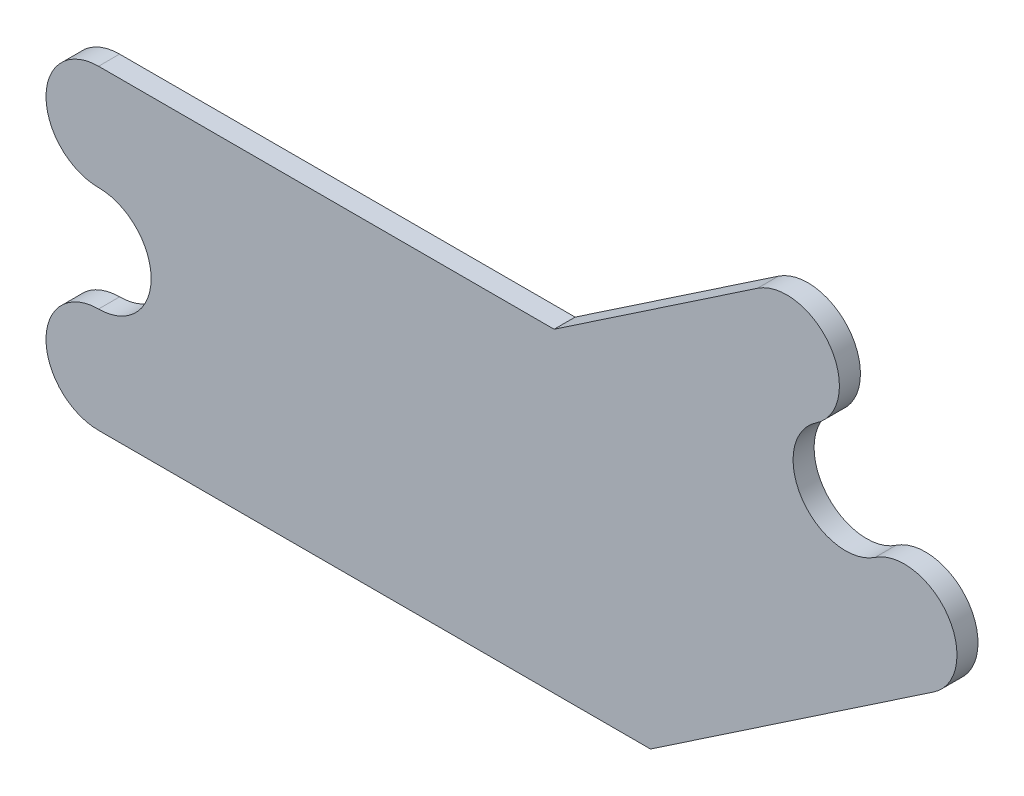
from build123d import *

# Parameters (mm, degrees)
SM_BASE_FLANGE_1_DEPTH = 1.2


# Sheet-metal steps are written as plain solids
with BuildPart() as part:
    # Sketch 1 → 基体-法兰1 (new body)
    with BuildSketch(Plane.XY):
        with BuildLine():
            Line((0, 0), (-26, 0))
            ThreePointArc((-26, 0), (-29, 3), (-26, 6))
            ThreePointArc((-26, 6), (-23, 9), (-26, 12))
            ThreePointArc((-26, 12), (-29, 15), (-26, 18))
            Line((-26, 18), (0, 18))
            Line((0, 18), (11.606526016, 25.828700649))
            ThreePointArc((11.606526016, 25.828700649), (15.771217444, 25.019166641), (14.961683437, 20.854475213))
            ThreePointArc((14.961683437, 20.854475213), (14.152149429, 16.689783785), (18.316840857, 15.880249778))
            ThreePointArc((18.316840857, 15.880249778), (22.481532285, 15.070715771), (21.671998278, 10.906024343))
            Line((21.671998278, 10.906024343), (5.503152266, 0))
            Line((5.503152266, 0), (0, 0))
        make_face()
    extrude(amount=-SM_BASE_FLANGE_1_DEPTH)


solid = part.part
